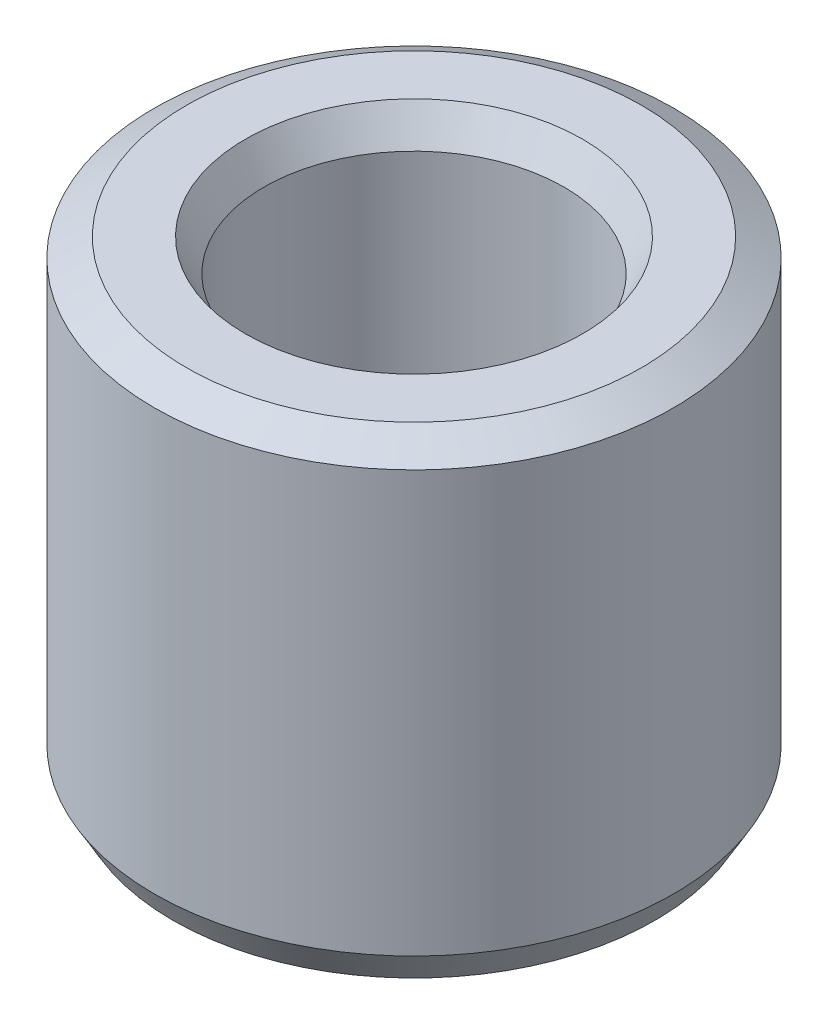
from build123d import *
from OCP.BRepFilletAPI import BRepFilletAPI_MakeChamfer

# Parameters (mm, degrees)
SKETCH1_R           = 47.5
BOSS_EXTRUDE1_DEPTH = 86.313688648
SKETCH2_R           = 27.452321188
CUT_EXTRUDE1_DEPTH  = 110.373455865
CHAMFER1_SIZE       = 3.399853445
CHAMFER1_SIZE2      = 5.888718905


with BuildPart() as part:
    # Sketch1 → Boss-Extrude1 (new body)
    with BuildSketch(Plane(origin=(0, 0, 0), x_dir=(1, 0, 0), z_dir=(0, 1, 0))):
        Circle(SKETCH1_R)
    extrude(amount=BOSS_EXTRUDE1_DEPTH)

    # Sketch2 → Cut-Extrude1 (cut, through all)
    with BuildSketch(Plane(origin=(0, 0, 0), x_dir=(1, 0, 0), z_dir=(0, 1, 0))):
        Circle(SKETCH2_R)
    extrude(amount=CUT_EXTRUDE1_DEPTH, mode=Mode.SUBTRACT)

    # Chamfer1: one chamfer whose edges measure the first distance from different faces: ONE call of the kernel's chamfer builder (chamfer() names one face for all edges)
    chamfer1_edges_1 = [part.edges().sort_by_distance(p)[0] for p in [
        (-27.452321188, 86.313688648, 0),
    ]]
    chamfer1_side_1 = [part.faces().sort_by_distance(p)[0] for p in [
        (-46.156497116, 86.313688648, 0),
    ]]
    chamfer1_edges_2 = [part.edges().sort_by_distance(p)[0] for p in [
        (-27.452321188, 0, 0),
    ]]
    chamfer1_side_2 = [part.faces().sort_by_distance(p)[0] for p in [
        (-27.452321188, 43.156844324, 0),
    ]]
    chamfer1_edges_3 = [part.edges().sort_by_distance(p)[0] for p in [
        (-47.5, 0, 0),
    ]]
    chamfer1_side_3 = [part.faces().sort_by_distance(p)[0] for p in [
        (-46.156497116, 0, 0),
    ]]
    chamfer1_edges_4 = [part.edges().sort_by_distance(p)[0] for p in [
        (-47.5, 86.313688648, 0),
    ]]
    chamfer1_side_4 = [part.faces().sort_by_distance(p)[0] for p in [
        (-47.5, 43.156844324, 0),
    ]]
    chamfer1 = BRepFilletAPI_MakeChamfer(part.part.solid().wrapped)
    for e in chamfer1_edges_1:
        chamfer1.Add(CHAMFER1_SIZE, CHAMFER1_SIZE2, e.wrapped, chamfer1_side_1[0].wrapped)  # the first distance lies on this face
    for e in chamfer1_edges_2:
        chamfer1.Add(CHAMFER1_SIZE, CHAMFER1_SIZE2, e.wrapped, chamfer1_side_2[0].wrapped)  # the first distance lies on this face
    for e in chamfer1_edges_3:
        chamfer1.Add(CHAMFER1_SIZE, CHAMFER1_SIZE2, e.wrapped, chamfer1_side_3[0].wrapped)  # the first distance lies on this face
    for e in chamfer1_edges_4:
        chamfer1.Add(CHAMFER1_SIZE, CHAMFER1_SIZE2, e.wrapped, chamfer1_side_4[0].wrapped)  # the first distance lies on this face
    add(Compound.cast(chamfer1.Shape()), mode=Mode.REPLACE)


solid = part.part
